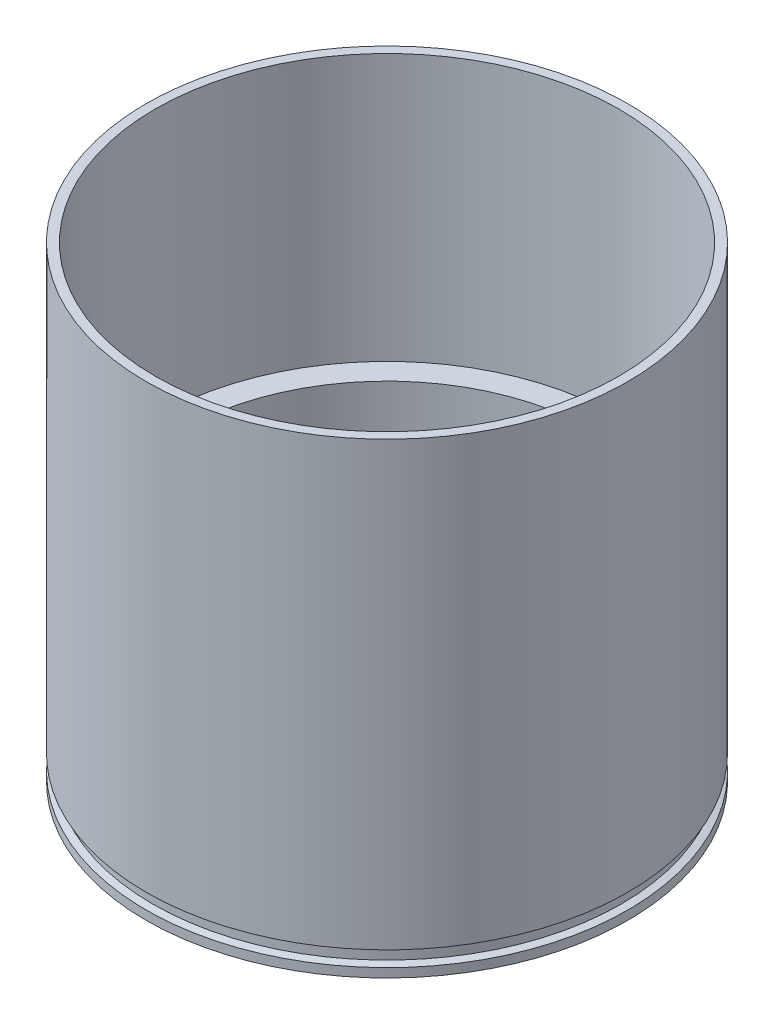
from build123d import *

# Parameters (mm, degrees)
SKETCH_1_R          = 72.25
SKETCH_1_R_2        = 71
EXTRUDE_1_DEPTH     = 140
SKETCH_2_W          = 2
SKETCH_2_H          = 3
CHAMFER_3_SIZE      = 0.803847577
CHAMFER_3_SIZE_2    = 3
CHAMFER_5_SIZE      = 3
CHAMFER_5_SIZE_2    = 0.803847577
SKETCH_3_R          = 62.25
CUT_EXTRUDE_7_DEPTH = 135
CUT_EXTRUDE_START   = 135
SKETCH_8_R          = 69.5
CUT_EXTRUDE_9_DEPTH = 80


with BuildPart() as part:
    # 草圖1 → 填料-伸長1 (new body)
    # profile 1 of 2: a face of its own
    with BuildSketch(Plane(origin=(0, 0, 0), x_dir=(1, 0, 0), z_dir=(0, 1, 0))):
        with Locations(Location((0, 0, 0), (0, 0, 270))):
            Circle(SKETCH_1_R)
        Circle(SKETCH_1_R_2, mode=Mode.SUBTRACT)
    # profile 2 of 2: a face of its own
    with BuildSketch(Plane(origin=(0, 0, 0), x_dir=(1, 0, 0), z_dir=(0, 1, 0))):
        Circle(SKETCH_1_R_2)
    extrude(amount=EXTRUDE_1_DEPTH)

    # 草圖2 → 除料-旋轉1 (revolve, cut)
    with BuildSketch(Plane.XY, mode=Mode.PRIVATE) as cut_revolve_1_sk:
        with Locations((71.25, 5)):
            Rectangle(SKETCH_2_W, SKETCH_2_H)
    revolve(cut_revolve_1_sk.sketch.rotate(Axis((0, 0, 0), (0, 1, 0)), 90), axis=Axis((0, 0, 0), (0, 1, 0)), mode=Mode.SUBTRACT)

    # 導角3
    # the kernel refuses this chamfer: 3, 0.803847577 mm, written as the material it takes off along each edge
    with BuildSketch(Plane(origin=(0, 3.5, 0), x_dir=(0, 0, 1), z_dir=(1, 0, 0))) as chamfer_3_piece_1_section:
        Polygon((72.25, CHAMFER_3_SIZE), (72.25 - CHAMFER_3_SIZE_2, 0), (72.25, 0), align=None)
    chamfer_3_piece_1 = revolve(axis=Axis((0, 3.5, 0), (0, -1, 0)), mode=Mode.PRIVATE)
    chamfer_3_piece_1 = chamfer_3_piece_1 - Plane(origin=(0, 3.028349799, 0), x_dir=(0, 0, -1), z_dir=(0, 1, 0)) * Cylinder(70.25, 289, mode=Mode.PRIVATE)
    add(chamfer_3_piece_1, mode=Mode.SUBTRACT)

    # 導角5
    # the kernel refuses this chamfer: 3, 0.803847577 mm, written as the material it takes off along each edge
    with BuildSketch(Plane(origin=(0, 6.5, 0), x_dir=(0, 0, 1), z_dir=(1, 0, 0))) as chamfer_5_piece_1_section:
        Polygon((72.25 - CHAMFER_5_SIZE, 0), (72.25, -CHAMFER_5_SIZE_2), (72.25, 0), align=None)
    chamfer_5_piece_1 = revolve(axis=Axis((0, 6.5, 0), (0, -1, 0)), mode=Mode.PRIVATE)
    chamfer_5_piece_1 = chamfer_5_piece_1 - Plane(origin=(0, 6.971650201, 0), x_dir=(0, 0, -1), z_dir=(0, 1, 0)) * Cylinder(70.25, 289, mode=Mode.PRIVATE)
    add(chamfer_5_piece_1, mode=Mode.SUBTRACT)

    # 草圖3 → 除料-伸長7 (cut)
    with BuildSketch(Plane(origin=(0, 140, 0), x_dir=(1, 0, 0), z_dir=(0, 1, 0))):
        with Locations(Location((0, 0, 0), (0, 0, 270))):
            Circle(SKETCH_3_R)
    extrude(amount=-CUT_EXTRUDE_7_DEPTH, mode=Mode.SUBTRACT)

    # 草圖8 → 除料-伸長9 (cut)
    with BuildSketch(Plane(origin=(0, 5, 0), x_dir=(1, 0, 0), z_dir=(0, 1, 0)).offset(CUT_EXTRUDE_START)):
        with Locations(Location((0, 0, 0), (0, 0, 270))):
            Circle(SKETCH_8_R)
    extrude(amount=-CUT_EXTRUDE_9_DEPTH, mode=Mode.SUBTRACT)


solid = part.part
